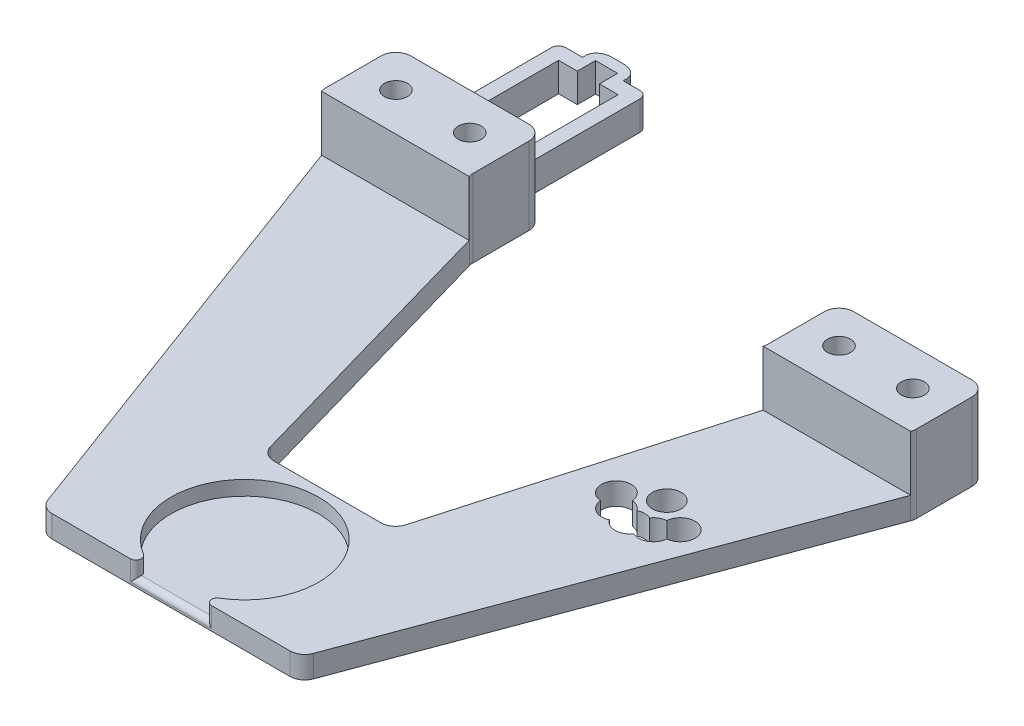
from build123d import *

# Parameters (mm, degrees)
SKETCH1_R            = 3.96875
BOSS_EXTRUDE2_DEPTH  = 40.64
SKETCH7_W            = 321.437634852
SKETCH7_H            = 153.081921076
CUT_EXTRUDE3_DEPTH   = 33.02
EXTRUDE_THIN1_DEPTH  = 10
SKETCH14_R           = 1.950000064
CUT_EXTRUDE6_DEPTH   = 20
BOSS_EXTRUDE4_DEPTH  = 5
MIRROR5_COPY_1_DEPTH = 5
FILLET3_R            = 2.54
SKETCH20_W           = 13.97
SKETCH20_H           = 5.08
BOSS_EXTRUDE5_DEPTH  = 10
FILLET7_SIZE         = 3.81
FILLET7_SIZE_2       = 5.08
FILLET6_SIZE         = 3.81
FILLET6_SIZE_2       = 5.08
CUT_EXTRUDE10_START  = -5
SKETCH19_W           = 7.62
SKETCH19_H           = 10.16
CUT_EXTRUDE10_DEPTH  = 6.27
MIRROR6_OUTLINE_W    = 7.62
MIRROR6_OUTLINE_H    = 5
MIRROR6_DEPTH        = 10
MIRROR6_2_DEPTH      = 10
SKETCH21_W           = 77.087164644
SKETCH21_H           = 69.073945867
CUT_EXTRUDE11_DEPTH  = 210.74909516
SKETCH23_R           = 5.08
CUT_EXTRUDE12_DEPTH  = 255.54404949
SKETCH22_R           = 4.953
CUT_EXTRUDE13_DEPTH  = 255.54404949
CUT_EXTRUDE14_START  = 19.05
SKETCH24_W           = 240.575030827
SKETCH24_H           = 80.300707095
CUT_EXTRUDE14_DEPTH  = 235.389112867
SKETCH25_R           = 25.4
CUT_EXTRUDE15_DEPTH  = 5
FILLET10_R           = 1.905


# Read off the part's stored shape, not the designer's step: Mirror6
with BuildPart() as part:
    # Sketch1 → Boss-Extrude2 (new body)
    with BuildSketch(Plane(origin=(0, 0, 0), x_dir=(1, 0, 0), z_dir=(0, 1, 0))):
        with BuildLine():
            Line((-96.52, 178.942765331), (-55.88, 178.942765331))
            ThreePointArc((-55.88, 178.942765331), (-52.287897552, 177.454867779), (-50.8, 173.862765331))
            Line((-50.8, 173.862765331), (-50.8, 154.610881096))
            ThreePointArc((-50.8, 154.610881096), (-50.750979429, 153.906859803), (-50.604863787, 153.216425724))
            Line((-50.604863787, 153.216425724), (-23.277092285, 57.485544628))
            ThreePointArc((-23.277092285, 57.485544628), (-21.451849938, 54.824742099), (-18.392228498, 53.8))
            Line((-18.392228498, 53.8), (0, 53.8))
            Line((0, 53.8), (0, 0))
            Line((0, 0), (-40.91748188, 0))
            ThreePointArc((-40.91748188, 0), (-43.817717665, 0.909264766), (-45.679732106, 3.31156205))
            Line((-45.679732106, 3.31156205), (-101.282250226, 153.044327381))
            ThreePointArc((-101.282250226, 153.044327381), (-101.519931557, 153.914386555), (-101.6, 154.812765331))
            Line((-101.6, 154.812765331), (-101.6, 173.862765331))
            ThreePointArc((-101.6, 173.862765331), (-100.112102448, 177.454867779), (-96.52, 178.942765331))
        make_face()
        with Locations(Location((-88.9, 166.242765331, 0), (0, 0, 270))):
            Circle(SKETCH1_R, mode=Mode.SUBTRACT)
        with Locations(Location((-63.5, 166.242765331, 0), (0, 0, 270))):
            Circle(SKETCH1_R, mode=Mode.SUBTRACT)
    boss_extrude2 = extrude(amount=BOSS_EXTRUDE2_DEPTH)

    # Mirror1: Boss-Extrude2 across plane
    add(boss_extrude2.mirror(Plane(origin=(0, 40.64, -53.8), x_dir=(0, 0, 1), z_dir=(-1, 0, 0))))

    # Sketch7 → Cut-Extrude3 (cut)
    with BuildSketch(Plane(origin=(0, 40.64, 0), x_dir=(1, 0, 0), z_dir=(0, 1, 0))):
        with Locations((5.589227859, 76.540960538)):
            Rectangle(SKETCH7_W, SKETCH7_H)
    extrude(amount=-CUT_EXTRUDE3_DEPTH, mode=Mode.SUBTRACT)

    # Sketch9 → Extrude-Thin1 (add)
    with BuildSketch(Plane(origin=(0, 0, 0), x_dir=(1, 0, 0), z_dir=(0, 1, 0))):
        Polygon((-91.44, 173.942765331), (-91.44, 224.742765331), (-60.96, 224.742765331), (-60.96, 173.942765331), (-65.96, 173.942765331), (-65.96, 219.742765331), (-86.44, 219.742765331), (-86.44, 173.942765331), align=None)
    extrude_thin1 = extrude(amount=EXTRUDE_THIN1_DEPTH)

    # Sketch14 → Cut-Extrude6 (cut)
    with BuildSketch(Plane.XZ):
        with Locations(Location((-81.2, -174.942765331, 0), (0, 0, 270))):
            Circle(SKETCH14_R)
        with Locations(Location((-71.2, -174.942765331, 0), (0, 0, 270))):
            Circle(SKETCH14_R)
    cut_extrude6 = extrude(amount=-CUT_EXTRUDE6_DEPTH, mode=Mode.SUBTRACT)

    # Sketch18 → Boss-Extrude4 (add)
    with BuildSketch(Plane(origin=(-60.96, 10, -178.942765331), x_dir=(0, 0, 1), z_dir=(-1, 0, 0))):
        Polygon((-1.27, 0), (0, 1.524), (0, 0), align=None)
    boss_extrude4 = extrude(amount=BOSS_EXTRUDE4_DEPTH)

    # Mirror3: Boss-Extrude4 across plane
    add(boss_extrude4.mirror(Plane(origin=(-76.2, 0, 0), x_dir=(0, 0, 1), z_dir=(1, 0, 0))))

    # Mirror5: Extrude-Thin1, Cut-Extrude6, Boss-Extrude4 across plane
    add(extrude_thin1.mirror(Plane(origin=(0, 0, 0), x_dir=(0, 0, 1), z_dir=(1, 0, 0))))
    add(cut_extrude6.mirror(Plane(origin=(0, 0, 0), x_dir=(0, 0, 1), z_dir=(1, 0, 0))), mode=Mode.SUBTRACT)
    add(boss_extrude4.mirror(Plane(origin=(0, 0, 0), x_dir=(0, 0, 1), z_dir=(1, 0, 0))))

    # Mirror5 copy 1 sketch → Mirror5 copy 1 (add)
    with BuildSketch(Plane(origin=(91.44, 10, -178.942765331), x_dir=(0, 0, 1), z_dir=(-1, 0, 0))):
        Polygon((-1.27, 0), (0, 1.524), (0, 0), align=None)
    extrude(amount=MIRROR5_COPY_1_DEPTH)

    # Fillet3
    fillet3_edges = [part.edges().sort_by_distance(p)[0] for p in [
        (-91.44, 5, -224.742765331),
        (-60.96, 5, -224.742765331),
        (91.44, 5, -224.742765331),
        (60.96, 5, -224.742765331),
    ]]
    fillet(fillet3_edges, radius=FILLET3_R)

    # Sketch20 → Boss-Extrude5 (add)
    with BuildSketch(Plane(origin=(0, 0, 0), x_dir=(1, 0, 0), z_dir=(0, 1, 0))):
        with Locations((-76.2, 227.282765331)):
            Rectangle(SKETCH20_W, SKETCH20_H)
    extrude(amount=BOSS_EXTRUDE5_DEPTH)

    # Fillet7
    # an asymmetric fillet: 5.08, 3.81 mm, written as the material it takes off along each edge
    with BuildSketch(Plane(origin=(-83.185, -12.7, -229.822765331), x_dir=(0, 0, 1), z_dir=(0, 1, 0))) as fillet7_piece_1:
        with BuildLine():
            Bezier((FILLET7_SIZE, 0), (0, 0), (0, FILLET7_SIZE_2), weights=[1, 0.707106781, 1])
            Line((0, FILLET7_SIZE_2), (0, 0))
            Line((0, 0), (FILLET7_SIZE, 0))
        make_face()
    extrude(amount=35.4, mode=Mode.SUBTRACT)

    # Fillet6
    # an asymmetric fillet: 5.08, 3.81 mm, written as the material it takes off along each edge
    with BuildSketch(Plane(origin=(-69.215, -12.7, -229.822765331), x_dir=(0, 0, 1), z_dir=(0, 1, 0))) as fillet6_piece_1:
        with BuildLine():
            Bezier((FILLET6_SIZE, 0), (0, 0), (0, -FILLET6_SIZE_2), weights=[1, 0.707106781, 1])
            Line((0, -FILLET6_SIZE_2), (0, 0))
            Line((0, 0), (FILLET6_SIZE, 0))
        make_face()
    extrude(amount=35.4, mode=Mode.SUBTRACT)

    # Sketch19 → Cut-Extrude10 (cut)
    with BuildSketch(Plane(origin=(0, 0, -224.742765331), x_dir=(-1, 0, 0), z_dir=(0, 0, -1)).offset(CUT_EXTRUDE10_START)):
        with Locations((76.2, 4.92)):
            Rectangle(SKETCH19_W, SKETCH19_H)
    extrude(amount=CUT_EXTRUDE10_DEPTH, mode=Mode.SUBTRACT)

    # Mirror6 outline → Mirror6 (cut)
    with BuildSketch(Plane(origin=(0, 0, 0), x_dir=(1, 0, 0), z_dir=(0, 1, 0))):
        with Locations((76.2, 222.242765331)):
            Rectangle(MIRROR6_OUTLINE_W, MIRROR6_OUTLINE_H)
    extrude(amount=MIRROR6_DEPTH, mode=Mode.SUBTRACT)

    # Mirror6 2 outline → Mirror6 2 (add)
    with BuildSketch(Plane(origin=(0, 0, 0), x_dir=(1, 0, 0), z_dir=(0, 1, 0))):
        with BuildLine():
            add(Edge.make_bspline(
                [(78.105, 229.822765331), (83.185, 229.822765331), (83.185, 226.012765331)],
                knots=[0, 0, 0, 1, 1, 1], degree=2, weights=[1, 0.707106781, 1]))
            Line((78.105, 229.822765331), (74.295, 229.822765331))
            add(Edge.make_bspline(
                [(69.215, 226.012765331), (69.215, 229.822765331), (74.295, 229.822765331)],
                knots=[0, 0, 0, 1, 1, 1], degree=2, weights=[1, 0.707106781, 1]))
            Line((69.215, 226.012765331), (69.215, 224.742765331))
            Line((69.215, 224.742765331), (72.39, 224.742765331))
            Line((72.39, 224.742765331), (72.39, 226.012765331))
            Line((72.39, 226.012765331), (80.01, 226.012765331))
            Line((80.01, 226.012765331), (80.01, 224.742765331))
            Line((80.01, 224.742765331), (83.185, 224.742765331))
            Line((83.185, 224.742765331), (83.185, 226.012765331))
        make_face()
    extrude(amount=MIRROR6_2_DEPTH)

    # Sketch21 → Cut-Extrude11 (cut, through all)
    with BuildSketch(Plane(origin=(0, 0, -178.942765331), x_dir=(-1, 0, 0), z_dir=(0, 0, -1))):
        with Locations((78.752430528, 22.788762469)):
            Rectangle(SKETCH21_W, SKETCH21_H)
    extrude(amount=CUT_EXTRUDE11_DEPTH, mode=Mode.SUBTRACT)

    # Sketch23 → Cut-Extrude12 (cut, through all)
    with BuildSketch(Plane.XZ):
        with Locations((-67.31, -98.573931837)):
            Circle(SKETCH23_R)
        with Locations((-71.958522628, -103.222454465)):
            Circle(SKETCH23_R)
        with Locations((-60.96, -96.872454465)):
            Circle(SKETCH23_R)
        with Locations((-54.61, -98.573931837)):
            Circle(SKETCH23_R)
        with Locations((-49.961477372, -103.222454465)):
            Circle(SKETCH23_R)
    extrude(amount=-CUT_EXTRUDE12_DEPTH, mode=Mode.SUBTRACT)

    # Sketch22 → Cut-Extrude13 (cut, through all)
    with BuildSketch(Plane.XZ):
        with Locations(Location((-60.96, -109.572454465, 0), (0, 0, 270))):
            Circle(SKETCH22_R)
    extrude(amount=-CUT_EXTRUDE13_DEPTH, mode=Mode.SUBTRACT)

    # Sketch24 → Cut-Extrude14 (cut, through all)
    with BuildSketch(Plane(origin=(0, 7.62, 0), x_dir=(1, 0, 0), z_dir=(0, 1, 0)).offset(CUT_EXTRUDE14_START)):
        with Locations((-12.016343346, 155.193868331)):
            Rectangle(SKETCH24_W, SKETCH24_H)
    extrude(amount=CUT_EXTRUDE14_DEPTH, mode=Mode.SUBTRACT)

    # Sketch25 → Cut-Extrude15 (cut)
    with BuildSketch(Plane(origin=(0, 7.62, 0), x_dir=(1, 0, 0), z_dir=(0, 1, 0))):
        with Locations((0, 25.352)):
            Circle(SKETCH25_R)
    extrude(amount=-CUT_EXTRUDE15_DEPTH, mode=Mode.SUBTRACT)

    # Fillet10
    fillet10_edges = [part.edges().sort_by_distance(p)[0] for p in [
        (0, 2.62, 0),
        (-1.560799795, 5.12, 0),
        (1.560799795, 5.12, 0),
    ]]
    fillet(fillet10_edges, radius=FILLET10_R)


with BuildPart() as body_2:
    # Mirror16: mirrored copy
    add(part.part.mirror(Plane(origin=(119.38, 0, 0), x_dir=(0, 0, 1), z_dir=(1, 0, 0))))


solid = body_2.part
